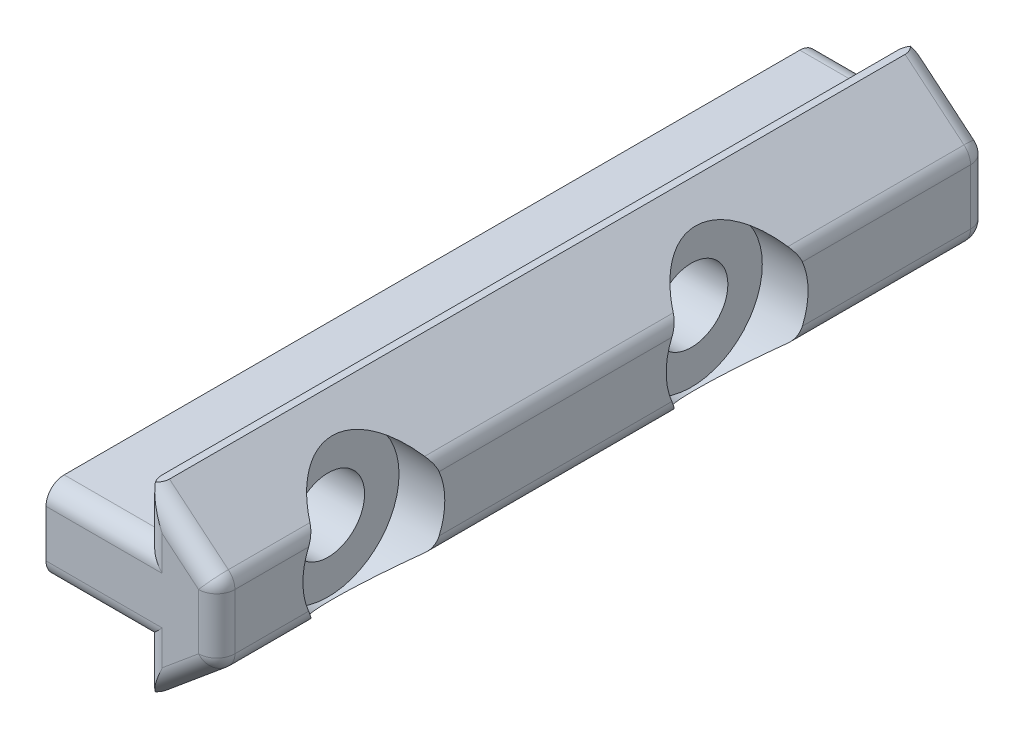
from build123d import *

# Parameters (mm, degrees)
BOSS_EXTRUDE1_DEPTH                             = 53.975
SKETCH2_W                                       = 6.858
SKETCH2_H                                       = 3.429
CUT_EXTRUDE1_DEPTH                              = 55.91468839
SKETCH4_W                                       = 6.858
SKETCH4_H                                       = 3.429
CUT_EXTRUDE2_DEPTH                              = 55.91468839
F_3_CLEARANCE_HOLE1_D                           = 2.7686
CBORE_FOR_10_BUTTON_HEAD_CAP_SCREW1_D           = 5.1054
CBORE_FOR_10_BUTTON_HEAD_CAP_SCREW1_CBORE_D     = 9.92124
CBORE_FOR_10_BUTTON_HEAD_CAP_SCREW1_CBORE_DEPTH = 3.2004
FILLET1_R                                       = 1.27
FILLET3_R                                       = 1.27
FILLET5_R                                       = 1.27


with BuildPart() as part:
    # Sketch1 → Boss-Extrude1 (new body)
    with BuildSketch(Plane.XY.offset(23.6855)):
        Polygon((3.302, 6.35), (-4.064, 6.35), (-4.064, -6.35), (3.302, -6.35), (7.874, -2.54), (7.874, 2.54), align=None)
    extrude(amount=-BOSS_EXTRUDE1_DEPTH)

    # Sketch2 → Cut-Extrude1 (cut, through all)
    with BuildSketch(Plane.XY.offset(23.6855)):
        with Locations((-0.635, 4.6355)):
            Rectangle(SKETCH2_W, SKETCH2_H)
    extrude(amount=-CUT_EXTRUDE1_DEPTH, mode=Mode.SUBTRACT)

    # Sketch4 → Cut-Extrude2 (cut, through all)
    with BuildSketch(Plane.XY.offset(23.6855)):
        with Locations((-0.635, -4.6355)):
            Rectangle(SKETCH4_W, SKETCH4_H)
    extrude(amount=-CUT_EXTRUDE2_DEPTH, mode=Mode.SUBTRACT)

    # #3 Clearance Hole1 (through all)
    with Locations(Plane.ZY.offset(4.064)):
        with Locations((12.7, 0), (-12.7, 0)):
            Hole(F_3_CLEARANCE_HOLE1_D / 2)

    # CBORE for #10 Button Head Cap Screw1 (through all)
    with Locations(Plane(origin=(7.874, 0, 0), x_dir=(0, 0, -1), z_dir=(1, 0, 0))):
        with Locations((-12.7, 0), (12.7, 0)):
            CounterBoreHole(CBORE_FOR_10_BUTTON_HEAD_CAP_SCREW1_D / 2, CBORE_FOR_10_BUTTON_HEAD_CAP_SCREW1_CBORE_D / 2, CBORE_FOR_10_BUTTON_HEAD_CAP_SCREW1_CBORE_DEPTH)

    # Fillet1
    fillet1_edges = [part.edges().sort_by_distance(p)[0] for p in [
        (7.874, -2.54, 20.323251747),
        (7.874, -2.54, -23.625251747),
        (7.874, -2.54, 0),
        (7.874, 2.54, 20.323251747),
        (7.874, 2.54, 0),
        (7.874, 2.54, -23.625251747),
    ]]
    fillet(fillet1_edges, radius=FILLET1_R)

    # Fillet3
    # the kernel refuses this fillet: 1.27 mm, written as the material it takes off along each edge
    with BuildSketch(Plane(origin=(0.862897437, -8.382585469, -30.2895), x_dir=(0, 0, 1), z_dir=(0.7682212795973759, 0.6401843996644799, 0)), Plane(origin=(7.417034188, 2.920804844, -30.2895), x_dir=(0, 0, 1), z_dir=(-0.7682212795973759, 0.6401843996644799, 0))) as fillet3_piece_1:
        with BuildLine():
            CenterArc((FILLET3_R, -FILLET3_R), FILLET3_R, 90, 90)
            Line((0, -FILLET3_R), (0, 0))
            Line((0, 0), (FILLET3_R, 0))
        make_face()
    extrude(amount=8.531574072, mode=Mode.SUBTRACT)
    with BuildSketch(Plane(origin=(6.604, -1.945163819, -30.2895), x_dir=(0.6401843996644796, -0.7682212795973762, 0), z_dir=(-0.7682212795973762, -0.6401843996644796, 0))) as fillet3_piece_2:
        with BuildLine():
            CenterArc((1.27 - FILLET3_R, FILLET3_R), FILLET3_R, 270, 90)
            Line((1.27, FILLET3_R), (1.27, 0))
            Line((1.27, 0), (1.27 - FILLET3_R, 0))
        make_face()
    revolve(axis=Axis((6.604, -1.945163819, -30.2895), (0, 0, 1)), revolution_arc=50.194428908, mode=Mode.SUBTRACT)
    with BuildSketch(Plane(origin=(6.604, 1.945163819, -30.2895), x_dir=(0.6401843996644799, 0.7682212795973757, 0), z_dir=(-0.7682212795973757, 0.6401843996644799, 0))) as fillet3_piece_3:
        with BuildLine():
            CenterArc((1.27 - FILLET3_R, -FILLET3_R), FILLET3_R, 0, 90)
            Line((1.27, -FILLET3_R), (1.27, 0))
            Line((1.27, 0), (1.27 - FILLET3_R, 0))
        make_face()
    revolve(axis=Axis((6.604, 1.945163819, -30.2895), (0, 0, -1)), revolution_arc=50.194428908, mode=Mode.SUBTRACT)
    with BuildSketch(Plane(origin=(2.794, -2.921, -30.2895), x_dir=(0, 0, 1), z_dir=(-1, 0, 0)), Plane(origin=(-7.239, 2.921, -30.2895), x_dir=(0, 0, 1), z_dir=(1, 0, 0))) as fillet3_piece_4:
        with BuildLine():
            CenterArc((FILLET3_R, FILLET3_R), FILLET3_R, 180, 90)
            Line((0, FILLET3_R), (0, 0))
            Line((0, 0), (FILLET3_R, 0))
        make_face()
    extrude(amount=10.033, mode=Mode.SUBTRACT)
    with BuildSketch(Plane(origin=(2.794, 2.921, -30.2895), x_dir=(0, 0, 1), z_dir=(0, 1, 0)), Plane(origin=(2.794, -9.525, -30.2895), x_dir=(0, 0, 1), z_dir=(0, 1, 0))) as fillet3_piece_5:
        with BuildLine():
            CenterArc((FILLET3_R, FILLET3_R), FILLET3_R, 180, 90)
            Line((0, FILLET3_R), (0, 0))
            Line((0, 0), (FILLET3_R, 0))
        make_face()
    extrude(amount=6.604, mode=Mode.SUBTRACT)
    with BuildSketch(Plane(origin=(7.874, -1.945163819, -30.2895), x_dir=(-1, 0, 0), z_dir=(0, 1, 0))) as fillet3_piece_6:
        with BuildLine():
            CenterArc((FILLET3_R, FILLET3_R), FILLET3_R, 180, 90)
            Line((0, FILLET3_R), (0, 0))
            Line((0, 0), (FILLET3_R, 0))
        make_face()
    extrude(amount=3.890327637, mode=Mode.SUBTRACT)
    with BuildSketch(Plane(origin=(2.794, -9.525, -30.2895), x_dir=(0, 0, 1), z_dir=(0, 1, 0))) as fillet3_piece_7a_section:
        with BuildLine():
            CenterArc((FILLET3_R, FILLET3_R), FILLET3_R, 180, 90)
            Line((0, FILLET3_R), (0, 0))
            Line((0, 0), (FILLET3_R, 0))
        make_face()
    fillet3_piece_7a = extrude(amount=9.779, mode=Mode.PRIVATE)
    fillet3_piece_7a = split(fillet3_piece_7a, bisect_by=Plane(origin=(3.081521795, -2.921, -30.001978205), z_dir=(0, 1, 0)), keep=Keep.TOP, mode=Mode.PRIVATE)
    with BuildSketch(Plane(origin=(5.969, -2.921, -30.2895), x_dir=(0, 0, 1), z_dir=(-1, 0, 0))) as fillet3_piece_7b_section:
        with BuildLine():
            CenterArc((FILLET3_R, FILLET3_R), FILLET3_R, 180, 90)
            Line((0, FILLET3_R), (0, 0))
            Line((0, 0), (FILLET3_R, 0))
        make_face()
    fillet3_piece_7b = extrude(amount=13.208, mode=Mode.PRIVATE)
    fillet3_piece_7b = split(fillet3_piece_7b, bisect_by=Plane(origin=(2.794, -2.633478205, -30.001978205), z_dir=(1, 0, 0)), keep=Keep.TOP, mode=Mode.PRIVATE)
    fillet3_piece_7 = fillet3_piece_7a & fillet3_piece_7b
    add(fillet3_piece_7, mode=Mode.SUBTRACT)
    with BuildSketch(Plane(origin=(2.794, -0.254, -30.2895), x_dir=(0, 0, 1), z_dir=(0, 1, 0))) as fillet3_piece_8a_section:
        with BuildLine():
            CenterArc((FILLET3_R, FILLET3_R), FILLET3_R, 180, 90)
            Line((0, FILLET3_R), (0, 0))
            Line((0, 0), (FILLET3_R, 0))
        make_face()
    fillet3_piece_8a = extrude(amount=9.779, mode=Mode.PRIVATE)
    fillet3_piece_8a = split(fillet3_piece_8a, bisect_by=Plane(origin=(3.081521795, 2.921, -30.001978205), z_dir=(0, -1, 0)), keep=Keep.TOP, mode=Mode.PRIVATE)
    with BuildSketch(Plane(origin=(-7.239, 2.921, -30.2895), x_dir=(0, 0, 1), z_dir=(1, 0, 0))) as fillet3_piece_8b_section:
        with BuildLine():
            CenterArc((FILLET3_R, FILLET3_R), FILLET3_R, 180, 90)
            Line((0, FILLET3_R), (0, 0))
            Line((0, 0), (FILLET3_R, 0))
        make_face()
    fillet3_piece_8b = extrude(amount=13.208, mode=Mode.PRIVATE)
    fillet3_piece_8b = split(fillet3_piece_8b, bisect_by=Plane(origin=(2.794, 2.633478205, -30.001978205), z_dir=(1, 0, 0)), keep=Keep.TOP, mode=Mode.PRIVATE)
    fillet3_piece_8 = fillet3_piece_8a & fillet3_piece_8b
    add(fillet3_piece_8, mode=Mode.SUBTRACT)

    # Fillet5
    # the kernel refuses this fillet: 1.27 mm, written as the material it takes off along each edge
    with BuildSketch(Plane(origin=(0.862897437, -8.382585469, 23.6855), x_dir=(-0.6401843996644799, 0.7682212795973759, 0), z_dir=(0.7682212795973759, 0.6401843996644799, 0)), Plane(origin=(7.417034188, 2.920804844, 23.6855), x_dir=(-0.6401843996644799, -0.7682212795973759, 0), z_dir=(-0.7682212795973759, 0.6401843996644799, 0))) as fillet5_piece_1:
        with BuildLine():
            CenterArc((FILLET5_R, -FILLET5_R), FILLET5_R, 90, 90)
            Line((0, -FILLET5_R), (0, 0))
            Line((0, 0), (FILLET5_R, 0))
        make_face()
    extrude(amount=8.531574072, mode=Mode.SUBTRACT)
    with BuildSketch(Plane(origin=(6.604, -1.945163819, 23.6855), x_dir=(1, 0, 0), z_dir=(0, 1, 0))) as fillet5_piece_2:
        with BuildLine():
            CenterArc((1.27 - FILLET5_R, FILLET5_R), FILLET5_R, 270, 90)
            Line((1.27, FILLET5_R), (1.27, 0))
            Line((1.27, 0), (1.27 - FILLET5_R, 0))
        make_face()
    revolve(axis=Axis((6.604, -1.945163819, 23.6855), (0, 0, -1)), revolution_arc=50.194428908, mode=Mode.SUBTRACT)
    with BuildSketch(Plane(origin=(6.604, 1.945163819, 23.6855), x_dir=(0.6401843996644799, 0.7682212795973757, 0), z_dir=(-0.7682212795973757, 0.6401843996644799, 0))) as fillet5_piece_3:
        with BuildLine():
            CenterArc((1.27 - FILLET5_R, FILLET5_R), FILLET5_R, 270, 90)
            Line((1.27, FILLET5_R), (1.27, 0))
            Line((1.27, 0), (1.27 - FILLET5_R, 0))
        make_face()
    revolve(axis=Axis((6.604, 1.945163819, 23.6855), (0, 0, -1)), revolution_arc=50.194428908, mode=Mode.SUBTRACT)
    with BuildSketch(Plane(origin=(2.794, 2.921, 23.6855), x_dir=(1, 0, 0), z_dir=(0, 1, 0)), Plane(origin=(2.794, -9.525, 23.6855), x_dir=(1, 0, 0), z_dir=(0, 1, 0))) as fillet5_piece_4:
        with BuildLine():
            CenterArc((FILLET5_R, FILLET5_R), FILLET5_R, 180, 90)
            Line((0, FILLET5_R), (0, 0))
            Line((0, 0), (FILLET5_R, 0))
        make_face()
    extrude(amount=6.604, mode=Mode.SUBTRACT)
    with BuildSketch(Plane(origin=(-7.239, 2.921, 23.6855), x_dir=(0, -1, 0), z_dir=(1, 0, 0)), Plane(origin=(2.794, -2.921, 23.6855), x_dir=(0, 1, 0), z_dir=(-1, 0, 0))) as fillet5_piece_5:
        with BuildLine():
            CenterArc((FILLET5_R, FILLET5_R), FILLET5_R, 180, 90)
            Line((0, FILLET5_R), (0, 0))
            Line((0, 0), (FILLET5_R, 0))
        make_face()
    extrude(amount=10.033, mode=Mode.SUBTRACT)
    with BuildSketch(Plane(origin=(7.874, -1.945163819, 23.6855), x_dir=(-1, 0, 0), z_dir=(0, 1, 0))) as fillet5_piece_6:
        with BuildLine():
            CenterArc((FILLET5_R, -FILLET5_R), FILLET5_R, 90, 90)
            Line((0, -FILLET5_R), (0, 0))
            Line((0, 0), (FILLET5_R, 0))
        make_face()
    extrude(amount=3.890327637, mode=Mode.SUBTRACT)
    with BuildSketch(Plane(origin=(2.794, -0.254, 23.6855), x_dir=(1, 0, 0), z_dir=(0, 1, 0))) as fillet5_piece_7a_section:
        with BuildLine():
            CenterArc((FILLET5_R, FILLET5_R), FILLET5_R, 180, 90)
            Line((0, FILLET5_R), (0, 0))
            Line((0, 0), (FILLET5_R, 0))
        make_face()
    fillet5_piece_7a = extrude(amount=9.779, mode=Mode.PRIVATE)
    fillet5_piece_7a = split(fillet5_piece_7a, bisect_by=Plane(origin=(3.081521795, 2.921, 23.397978205), z_dir=(0, -1, 0)), keep=Keep.TOP, mode=Mode.PRIVATE)
    with BuildSketch(Plane(origin=(-7.239, 2.921, 23.6855), x_dir=(0, -1, 0), z_dir=(1, 0, 0))) as fillet5_piece_7b_section:
        with BuildLine():
            CenterArc((FILLET5_R, FILLET5_R), FILLET5_R, 180, 90)
            Line((0, FILLET5_R), (0, 0))
            Line((0, 0), (FILLET5_R, 0))
        make_face()
    fillet5_piece_7b = extrude(amount=13.208, mode=Mode.PRIVATE)
    fillet5_piece_7b = split(fillet5_piece_7b, bisect_by=Plane(origin=(2.794, 2.633478205, 23.397978205), z_dir=(1, 0, 0)), keep=Keep.TOP, mode=Mode.PRIVATE)
    fillet5_piece_7 = fillet5_piece_7a & fillet5_piece_7b
    add(fillet5_piece_7, mode=Mode.SUBTRACT)
    with BuildSketch(Plane(origin=(2.794, -9.525, 23.6855), x_dir=(1, 0, 0), z_dir=(0, 1, 0))) as fillet5_piece_8a_section:
        with BuildLine():
            CenterArc((FILLET5_R, FILLET5_R), FILLET5_R, 180, 90)
            Line((0, FILLET5_R), (0, 0))
            Line((0, 0), (FILLET5_R, 0))
        make_face()
    fillet5_piece_8a = extrude(amount=9.779, mode=Mode.PRIVATE)
    fillet5_piece_8a = split(fillet5_piece_8a, bisect_by=Plane(origin=(3.081521795, -2.921, 23.397978205), z_dir=(0, 1, 0)), keep=Keep.TOP, mode=Mode.PRIVATE)
    with BuildSketch(Plane(origin=(5.969, -2.921, 23.6855), x_dir=(0, 1, 0), z_dir=(-1, 0, 0))) as fillet5_piece_8b_section:
        with BuildLine():
            CenterArc((FILLET5_R, FILLET5_R), FILLET5_R, 180, 90)
            Line((0, FILLET5_R), (0, 0))
            Line((0, 0), (FILLET5_R, 0))
        make_face()
    fillet5_piece_8b = extrude(amount=13.208, mode=Mode.PRIVATE)
    fillet5_piece_8b = split(fillet5_piece_8b, bisect_by=Plane(origin=(2.794, -2.633478205, 23.397978205), z_dir=(1, 0, 0)), keep=Keep.TOP, mode=Mode.PRIVATE)
    fillet5_piece_8 = fillet5_piece_8a & fillet5_piece_8b
    add(fillet5_piece_8, mode=Mode.SUBTRACT)


solid = part.part
